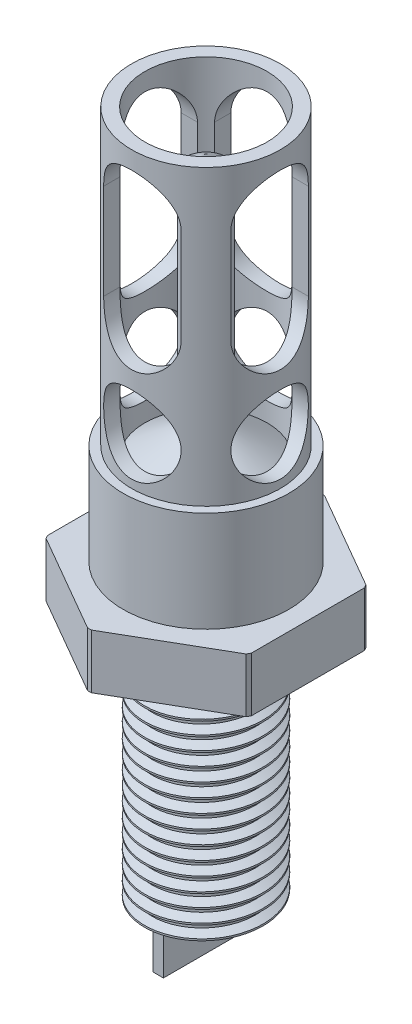
from build123d import *

# Parameters (mm, degrees)
SKETCH2_R           = 3.6195
CUT_EXTRUDE1_DEPTH  = 3.175
CIRPATTERN1_COUNT   = 4
SKETCH3_R           = 12.7
CUT_EXTRUDE2_DEPTH  = 40.92393631
CUT_SWEEP1_PITCH    = 1.27
SKETCH6_W           = 0.9906
SKETCH6_H           = 7.1882
BOSS_EXTRUDE1_DEPTH = 4.9276


with BuildPart() as part:
    # Sketch1 → Revolve1 (revolve)
    with BuildSketch(Plane.XY, mode=Mode.PRIVATE) as revolve1_sk:
        Polygon((0, 0), (5.53974, 0), (5.53974, 18.923), (4.7752, 18.923), (4.7752, 22.098), (6.35, 22.098), (6.35, 24.003), (8.5217, 24.003), (8.5217, 22.098), (10.8966, 22.098), (10.8966, 27.178), (7.747, 27.178), (7.747, 36.576), (6.9596, 36.576), (6.9596, 64.008), (5.715, 64.008), (5.715, 35.56), (1.8923, 37.973), (1.8923, 59.003524917), (0, 60.198), align=None)
    revolve(revolve1_sk.sketch.rotate(Axis((0, 0, 0), (0, 1, 0)), 90), axis=Axis((0, 0, 0), (0, 1, 0)))

    # Sketch2 → Cut-Extrude1 (cut)
    with BuildSketch(Plane.XY.offset(-6.9596)):
        with Locations(Location((0, 40.9575, 0), (0, 0, 90))):
            Circle(SKETCH2_R)
        with BuildLine():
            Line((3.6195, 58.7375), (3.6195, 49.8221))
            ThreePointArc((3.6195, 49.8221), (0, 46.2026), (-3.6195, 49.8221))
            Line((-3.6195, 49.8221), (-3.6195, 58.7375))
            ThreePointArc((-3.6195, 58.7375), (0, 62.357), (3.6195, 58.7375))
        make_face()
    cut_extrude1 = extrude(amount=CUT_EXTRUDE1_DEPTH, mode=Mode.SUBTRACT)

    # CirPattern1: Cut-Extrude1 ×4 about axis
    cirpattern1_axis = Axis((0, 0, 0), (0, 1, 0))
    for i in range(1, CIRPATTERN1_COUNT):
        add(cut_extrude1.rotate(cirpattern1_axis, i * 360 / CIRPATTERN1_COUNT), mode=Mode.SUBTRACT)

    # Sketch3 → Cut-Extrude2 (cut, through all)
    with BuildSketch(Plane(origin=(0, 27.178, 0), x_dir=(1, 0, 0), z_dir=(0, 1, 0))):
        Circle(SKETCH3_R)
        Polygon((9.525, 5.499261314), (0, 10.998522628), (-9.525, 5.499261314), (-9.525, -5.499261314), (0, -10.998522628), (9.525, -5.499261314), align=None, mode=Mode.SUBTRACT)
    extrude(amount=-CUT_EXTRUDE2_DEPTH, mode=Mode.SUBTRACT)

    # Cut-Sweep1: the profile of Sketch5 screwed along a right-hand helix of 18.25 turns, 8 arcs to a turn; built about Z, then put on its axis
    cut_sweep1_z = Axis((0, 0, 0), (0, 0, 1))
    cut_sweep1_corners = [(5.6769, 0, 0.634981373), (5.6769, 0, -0.634981373), (4.852035, 0, -0.158745343), (4.852035, 0, 0.158745343)]
    with BuildLine(mode=Mode.PRIVATE) as cut_sweep1_profile:
        Line(cut_sweep1_corners[0], cut_sweep1_corners[1])
        Line(cut_sweep1_corners[1], cut_sweep1_corners[2])
        Line(cut_sweep1_corners[2], cut_sweep1_corners[3])
        Line(cut_sweep1_corners[3], cut_sweep1_corners[0])
    cut_sweep1_cap = Face(cut_sweep1_profile.wire())
    cut_sweep1_turn_angles = [0, 22.5, 45, 67.5, 90, 112.5, 135, 157.5, 180, 202.5, 225, 247.5, 270, 292.5, 315, 337.5, 360]
    cut_sweep1_turn_weights = [1, 0.9238795325112867, 1, 0.9238795325112867, 1, 0.9238795325112867, 1, 0.9238795325112867, 1, 0.9238795325112867, 1, 0.9238795325112867, 1, 0.9238795325112867, 1, 0.9238795325112867, 1]
    cut_sweep1_turn_rails = [Edge.make_bspline([Vector(p[0], p[1], 0).rotate(cut_sweep1_z, cut_sweep1_turn_angles[k]) / cut_sweep1_turn_weights[k] + Vector(0, 0, p[2] + CUT_SWEEP1_PITCH * cut_sweep1_turn_angles[k] / 360) for k in range(17)], [0, 0, 0, 1, 1, 2, 2, 3, 3, 4, 4, 5, 5, 6, 6, 7, 7, 8, 8, 8], 2, cut_sweep1_turn_weights) for p in cut_sweep1_corners]
    cut_sweep1_turn_sides = [Face.make_surface_from_curves(cut_sweep1_turn_rails[p[0]], cut_sweep1_turn_rails[p[1]]) for p in [(0, 1), (1, 2), (2, 3), (3, 0)]]
    cut_sweep1_last_angles = [6480, 6502.5, 6525, 6547.5, 6570]
    cut_sweep1_last_weights = [1, 0.9238795325112867, 1, 0.9238795325112685, 1]
    cut_sweep1_last_rails = [Edge.make_bspline([Vector(p[0], p[1], 0).rotate(cut_sweep1_z, cut_sweep1_last_angles[k]) / cut_sweep1_last_weights[k] + Vector(0, 0, p[2] + CUT_SWEEP1_PITCH * cut_sweep1_last_angles[k] / 360) for k in range(5)], [0, 0, 0, 1, 1, 2, 2, 2], 2, cut_sweep1_last_weights) for p in cut_sweep1_corners]
    cut_sweep1_last_sides = [Face.make_surface_from_curves(cut_sweep1_last_rails[p[0]], cut_sweep1_last_rails[p[1]]) for p in [(0, 1), (1, 2), (2, 3), (3, 0)]]
    cut_sweep1 = Plane(origin=(0, -2.54, 0), x_dir=(1, 0, 0), z_dir=(0, 1, 0)) * Solid(Shell([*[p.moved(Location((0, 0, CUT_SWEEP1_PITCH * i))) for i in range(18) for p in cut_sweep1_turn_sides], *cut_sweep1_last_sides, cut_sweep1_cap, cut_sweep1_cap.rotate(cut_sweep1_z, 6570).moved(Location((0, 0, CUT_SWEEP1_PITCH * 6570 / 360)))]))
    add(cut_sweep1, mode=Mode.SUBTRACT)

    # Sketch6 → Boss-Extrude1 (add)
    with BuildSketch(Plane.XZ):
        with Locations((-0.88265, 0)):
            Rectangle(SKETCH6_W, SKETCH6_H)
    extrude(amount=BOSS_EXTRUDE1_DEPTH)


solid = part.part
